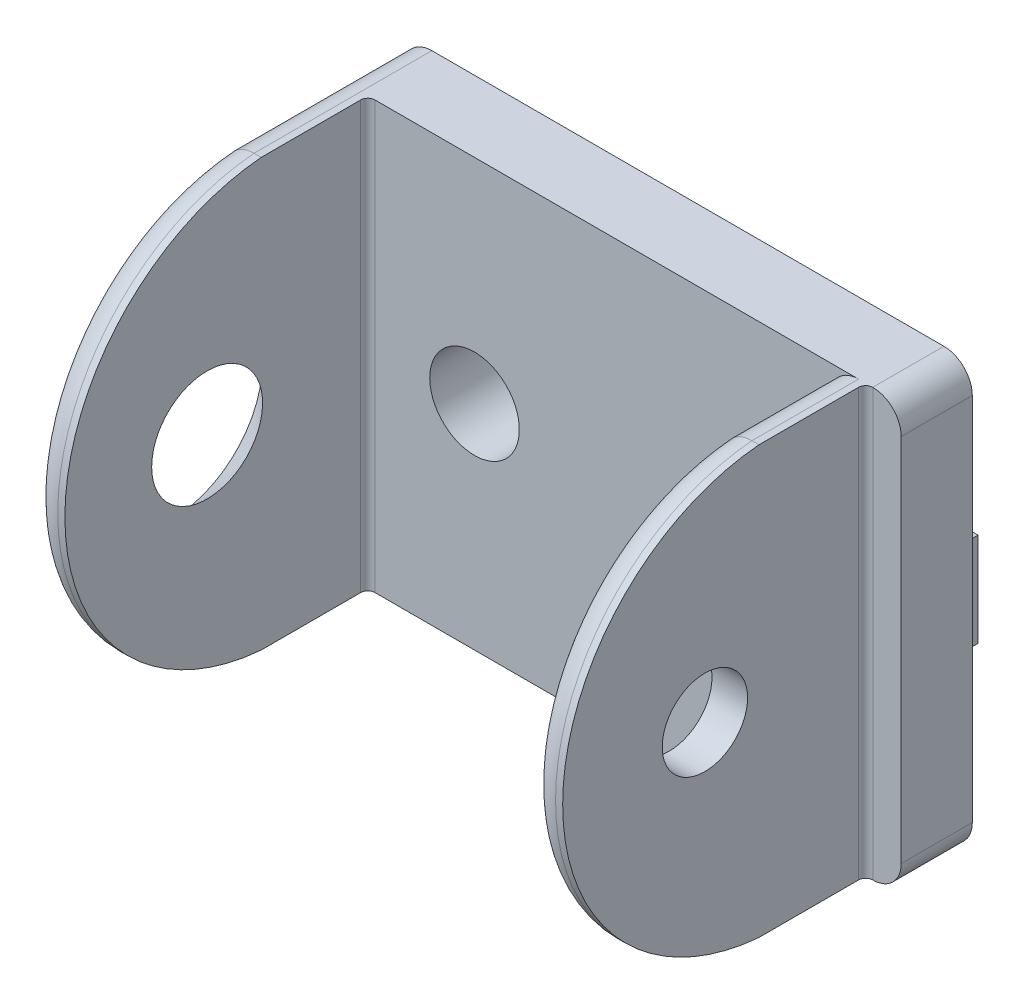
from build123d import *

# Parameters (mm, degrees)
SKETCH_1_W          = 40
SKETCH_1_H          = 30
EXTRUDE_1_DEPTH     = 5
SKETCH_2_W          = 2.5
SKETCH_2_H          = 30
EXTRUDE_2_DEPTH     = 27.5
SKETCH_3_W          = 6.6
SKETCH_3_H          = 3.25
CUT_EXTRUDE_1_DEPTH = 3
CUT_EXTRUDE_2_DEPTH = 58.063561053
SKETCH_3_4_W        = 3.25
SKETCH_3_4_H        = 3.3
EXTRUDE_3_DEPTH     = 1.4
SKETCH_4_W          = 2.5
SKETCH_4_H          = 30
EXTRUDE_4_DEPTH     = 22.5
CUT_EXTRUDE_3_DEPTH = 58.063561053
SKETCH_8_W          = 3
SKETCH_8_H          = 2.501
FILLET_3_R          = 0.5
FILLET_4_R          = 2


with BuildPart() as part:
    # 草图1 → 凸台-拉伸1 (new body)
    with BuildSketch(Plane.XY):
        with Locations((20, -15)):
            Rectangle(SKETCH_1_W, SKETCH_1_H)
    extrude(amount=EXTRUDE_1_DEPTH)

    # 草图2 → 凸台-拉伸2 (add)
    with BuildSketch(Plane.XY):
        with Locations((1.25, -15)):
            Rectangle(SKETCH_2_W, SKETCH_2_H)
    extrude(amount=EXTRUDE_2_DEPTH)

    # 草图3 → 切除-拉伸1 (cut)
    with BuildSketch(Plane(origin=(0, 0, 0), x_dir=(-1, 0, 0), z_dir=(0, 0, -1))):
        with Locations((-30, -7.625)):
            Rectangle(SKETCH_3_W, SKETCH_3_H)
        with Locations((-30, -22.375)):
            Rectangle(SKETCH_3_W, SKETCH_3_H)
        with Locations((-10, -22.375)):
            Rectangle(SKETCH_3_W, SKETCH_3_H)
        with Locations((-10, -7.625)):
            Rectangle(SKETCH_3_W, SKETCH_3_H)
    extrude(amount=-CUT_EXTRUDE_1_DEPTH, mode=Mode.SUBTRACT)

    # 草图3<3> → 切除-拉伸2 (cut, through all)
    with BuildSketch(Plane(origin=(0, 0, 0), x_dir=(-1, 0, 0), z_dir=(0, 0, -1))):
        with BuildLine():
            ThreePointArc((-33.15, -15), (-30, -18.15), (-26.85, -15))
            Line((-26.85, -15), (-33.15, -15))
        make_face()
        with BuildLine():
            Line((-33.15, -15), (-26.85, -15))
            ThreePointArc((-26.85, -15), (-30, -11.85), (-33.15, -15))
        make_face()
        with BuildLine():
            ThreePointArc((-13.15, -15), (-10, -18.15), (-6.85, -15))
            Line((-6.85, -15), (-13.15, -15))
        make_face()
        with BuildLine():
            Line((-13.15, -15), (-6.85, -15))
            ThreePointArc((-6.85, -15), (-10, -11.85), (-13.15, -15))
        make_face()
    extrude(amount=-CUT_EXTRUDE_2_DEPTH, mode=Mode.SUBTRACT)

    # 草图4 → 凸台-拉伸4 (add)
    with BuildSketch(Plane.XY.offset(5)):
        with Locations((36.25, -15)):
            Rectangle(SKETCH_4_W, SKETCH_4_H)
    extrude(amount=EXTRUDE_4_DEPTH)

    # 草图5 → 切除-拉伸3 (cut, through all)
    with BuildSketch(Plane.ZY):
        with BuildLine():
            Line((27.5, 0), (12.5, 0))
            ThreePointArc((12.5, 0), (26.301993223, -15), (12.5, -30))
            Line((12.5, -30), (27.5, -30))
            Line((27.5, -30), (27.5, 0))
        make_face()
    extrude(amount=-CUT_EXTRUDE_3_DEPTH, mode=Mode.SUBTRACT)

    # 草图8 → Hole Wizard M6 _1 (revolve, cut)
    with BuildSketch(Plane(origin=(37.5, -15, 16.301993223), x_dir=(0, 0, -1), z_dir=(0, 1, 0))):
        with Locations((1.5, 1.2505)):
            Rectangle(SKETCH_8_W, SKETCH_8_H)
    revolve(axis=Axis((43.85, -15, 16.301993223), (-1, 0, 0)), mode=Mode.SUBTRACT)

    # 草图10 → Hole Wizard M6 _1 2 (revolve, cut)
    with BuildSketch(Plane(origin=(0, -15, 16.3), x_dir=(0, 0, 1), z_dir=(0, 1, 0))):
        Polygon((0, 0), (0, 2.501), (3.3, 2.501), (3.3, 3.1), (6.4, 0), align=None)
    revolve(axis=Axis((-6.35, -15, 16.3), (1, 0, 0)), mode=Mode.SUBTRACT)

    # 圆角3
    fillet_3_edges = [part.edges().sort_by_distance(p)[0] for p in [
        (2.5, -15, 5),
        (37.5, -15, 5),
    ]]
    fillet(fillet_3_edges, radius=FILLET_3_R)

    # 圆角4
    # the kernel refuses this fillet: 2 mm, written as the material it takes off along each edge
    with BuildSketch(Plane(origin=(35, -30, 5), x_dir=(0, 1, 0), z_dir=(0, 0, 1)), Plane(origin=(35, 0, 5), x_dir=(1, 0, 0), z_dir=(0, 0, 1))) as fillet_4_piece_1:
        with BuildLine():
            CenterArc((FILLET_4_R, -FILLET_4_R), FILLET_4_R, 90, 90)
            Line((0, -FILLET_4_R), (-FILLET_4_R * 0.02, -FILLET_4_R))
            Line((-FILLET_4_R * 0.02, -FILLET_4_R), (-FILLET_4_R * 0.02, FILLET_4_R * 0.02))
            Line((-FILLET_4_R * 0.02, FILLET_4_R * 0.02), (FILLET_4_R, FILLET_4_R * 0.02))
            Line((FILLET_4_R, FILLET_4_R * 0.02), (FILLET_4_R, 0))
        make_face()
    extrude(amount=9.5, mode=Mode.SUBTRACT)
    with BuildSketch(Plane(origin=(0, 0, -2), x_dir=(1, 0, 0), z_dir=(0, 0, 1)), Plane(origin=(0, -30, -2), x_dir=(0, 1, 0), z_dir=(0, 0, 1))) as fillet_4_piece_2:
        with BuildLine():
            CenterArc((FILLET_4_R, -FILLET_4_R), FILLET_4_R, 90, 90)
            Line((0, -FILLET_4_R), (-FILLET_4_R * 0.02, -FILLET_4_R))
            Line((-FILLET_4_R * 0.02, -FILLET_4_R), (-FILLET_4_R * 0.02, FILLET_4_R * 0.02))
            Line((-FILLET_4_R * 0.02, FILLET_4_R * 0.02), (FILLET_4_R, FILLET_4_R * 0.02))
            Line((FILLET_4_R, FILLET_4_R * 0.02), (FILLET_4_R, 0))
        make_face()
    extrude(amount=16.5, mode=Mode.SUBTRACT)
    with BuildSketch(Plane(origin=(35, -15, 11.25), x_dir=(0, -0.998754097024609, -0.04990244158914389), z_dir=(0, 0.04990244158914389, -0.998754097024609))) as fillet_4_piece_3:
        with BuildLine():
            CenterArc((15.051993223 - FILLET_4_R, -FILLET_4_R), FILLET_4_R, 0, 90)
            Line((15.051993223 - FILLET_4_R, 0), (15.051993223 - FILLET_4_R, FILLET_4_R * 0.02))
            Line((15.051993223 - FILLET_4_R, FILLET_4_R * 0.02), (15.051993223 + FILLET_4_R * 0.02, FILLET_4_R * 0.02))
            Line((15.051993223 + FILLET_4_R * 0.02, FILLET_4_R * 0.02), (15.051993223 + FILLET_4_R * 0.02, -FILLET_4_R))
            Line((15.051993223 + FILLET_4_R * 0.02, -FILLET_4_R), (15.051993223, -FILLET_4_R))
        make_face()
    revolve(axis=Axis((35, -15, 11.25), (-1, 0, 0)), revolution_arc=185.720774622, mode=Mode.SUBTRACT)
    with BuildSketch(Plane(origin=(0, -15, 11.25), x_dir=(0, 0.9987540970246119, -0.04990244158908723), z_dir=(0, -0.04990244158908723, -0.9987540970246119))) as fillet_4_piece_4:
        with BuildLine():
            CenterArc((15.051993223 - FILLET_4_R, FILLET_4_R), FILLET_4_R, 270, 90)
            Line((15.051993223, FILLET_4_R), (15.051993223 + FILLET_4_R * 0.02, FILLET_4_R))
            Line((15.051993223 + FILLET_4_R * 0.02, FILLET_4_R), (15.051993223 + FILLET_4_R * 0.02, -FILLET_4_R * 0.02))
            Line((15.051993223 + FILLET_4_R * 0.02, -FILLET_4_R * 0.02), (15.051993223 - FILLET_4_R, -FILLET_4_R * 0.02))
            Line((15.051993223 - FILLET_4_R, -FILLET_4_R * 0.02), (15.051993223 - FILLET_4_R, 0))
        make_face()
    revolve(axis=Axis((0, -15, 11.25), (1, 0, 0)), revolution_arc=185.720774622, mode=Mode.SUBTRACT)
    with BuildSketch(Plane(origin=(40, 0, -2), x_dir=(-1, 0, 0), z_dir=(0, 0, 1)), Plane(origin=(40, -30, -2), x_dir=(0, 1, 0), z_dir=(0, 0, 1))) as fillet_4_piece_5:
        with BuildLine():
            CenterArc((FILLET_4_R, FILLET_4_R), FILLET_4_R, 180, 90)
            Line((0, FILLET_4_R), (-FILLET_4_R * 0.02, FILLET_4_R))
            Line((-FILLET_4_R * 0.02, FILLET_4_R), (-FILLET_4_R * 0.02, -FILLET_4_R * 0.02))
            Line((-FILLET_4_R * 0.02, -FILLET_4_R * 0.02), (FILLET_4_R, -FILLET_4_R * 0.02))
            Line((FILLET_4_R, -FILLET_4_R * 0.02), (FILLET_4_R, 0))
        make_face()
    extrude(amount=9, mode=Mode.SUBTRACT)


with BuildPart() as body_2:
    # 草图3<4> → 凸台-拉伸3 (new body)
    with BuildSketch(Plane(origin=(0, 0, 0), x_dir=(-1, 0, 0), z_dir=(0, 0, -1))):
        with Locations((-37.375, -13.35)):
            Rectangle(SKETCH_3_4_W, SKETCH_3_4_H)
        with Locations((-37.375, -16.65)):
            Rectangle(SKETCH_3_4_W, SKETCH_3_4_H)
        with Locations((-2.625, -13.35)):
            Rectangle(SKETCH_3_4_W, SKETCH_3_4_H)
        with Locations((-2.625, -16.65)):
            Rectangle(SKETCH_3_4_W, SKETCH_3_4_H)
    extrude(amount=EXTRUDE_3_DEPTH)


solid = Compound([part.part, body_2.part])
